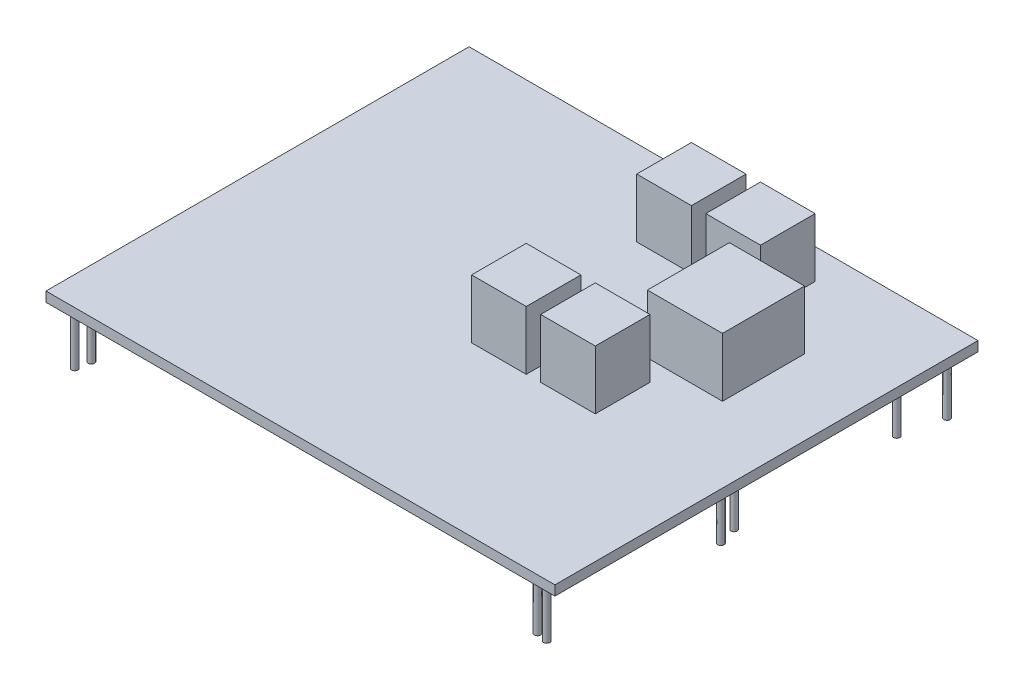
from build123d import *

# Parameters (mm, degrees)
SKETCH2_W           = 259.71
SKETCH2_H           = 215.9
BOSS_EXTRUDE1_DEPTH = 5
SKETCH1_R           = 1.6
BOSS_EXTRUDE2_DEPTH = 30
FANS_W              = 27.900833557
FANS_H              = 27.900833558
FANS_W_2            = 38.326934518
FANS_H_2            = 41.851250335
FANS_H_3            = 27.900833557
BOSS_EXTRUDE3_DEPTH = 30


with BuildPart() as part:
    # Sketch2 → Boss-Extrude1 (new body)
    with BuildSketch(Plane(origin=(0, 0, 0), x_dir=(1, 0, 0), z_dir=(0, 1, 0))):
        with Locations((-196.717193813, 0.240534117)):
            Rectangle(SKETCH2_W, SKETCH2_H)
    extrude(amount=BOSS_EXTRUDE1_DEPTH)

    # Sketch1 → Boss-Extrude2 (add)
    with BuildSketch(Plane(origin=(0, 0, 0), x_dir=(1, 0, 0), z_dir=(0, 1, 0))):
        with Locations((-320.092193813, 101.170534117)):
            Circle(SKETCH1_R)
        with Locations((-312.852193813, 99.850534117)):
            Circle(SKETCH1_R)
        with Locations((-318.832193813, -92.309465883)):
            Circle(SKETCH1_R)
        with Locations((-320.102193813, -99.489465883)):
            Circle(SKETCH1_R)
        with Locations((-177.862193813, -34.399465883)):
            Circle(SKETCH1_R)
        with Locations((-170.242193813, -34.399465883)):
            Circle(SKETCH1_R)
        with Locations((-104.382193813, -25.149465883)):
            Circle(SKETCH1_R)
        with Locations((-216.142193813, -6.769465883)):
            Circle(SKETCH1_R)
        with Locations((-77.992193813, -11.859465883)):
            Circle(SKETCH1_R)
        with Locations((-80.702193813, -2.389465883)):
            Circle(SKETCH1_R)
        with Locations((-84.902193813, -98.529465883)):
            Circle(SKETCH1_R)
        with Locations((-79.259756914, -99.489465883)):
            Circle(SKETCH1_R)
        with Locations((-104.372193813, 71.880534117)):
            Circle(SKETCH1_R)
        with Locations((-80.542193813, 80.410534117)):
            Circle(SKETCH1_R)
        with Locations((-75.622193813, 101.170534117)):
            Circle(SKETCH1_R)
        with Locations((-224.842193813, 89.780534117)):
            Circle(SKETCH1_R)
    extrude(amount=-BOSS_EXTRUDE2_DEPTH)

    # fans → Boss-Extrude3 (add)
    with BuildSketch(Plane(origin=(0, 5, 0), x_dir=(1, 0, 0), z_dir=(0, 1, 0))):
        with Locations((-146.055153933, -7.909446212)):
            Rectangle(FANS_W, FANS_H)
        with Locations((-124.395296303, 37.09900371)):
            Rectangle(FANS_W_2, FANS_H_2)
        with Locations((-181.151465618, -8.056292705)):
            Rectangle(FANS_W, FANS_H_3)
        with Locations((-148.478121058, 78.803407554)):
            Rectangle(FANS_W, FANS_H_3)
        with Locations((-183.574432743, 78.656561061)):
            Rectangle(FANS_W, FANS_H_3)
    extrude(amount=BOSS_EXTRUDE3_DEPTH)


solid = part.part
